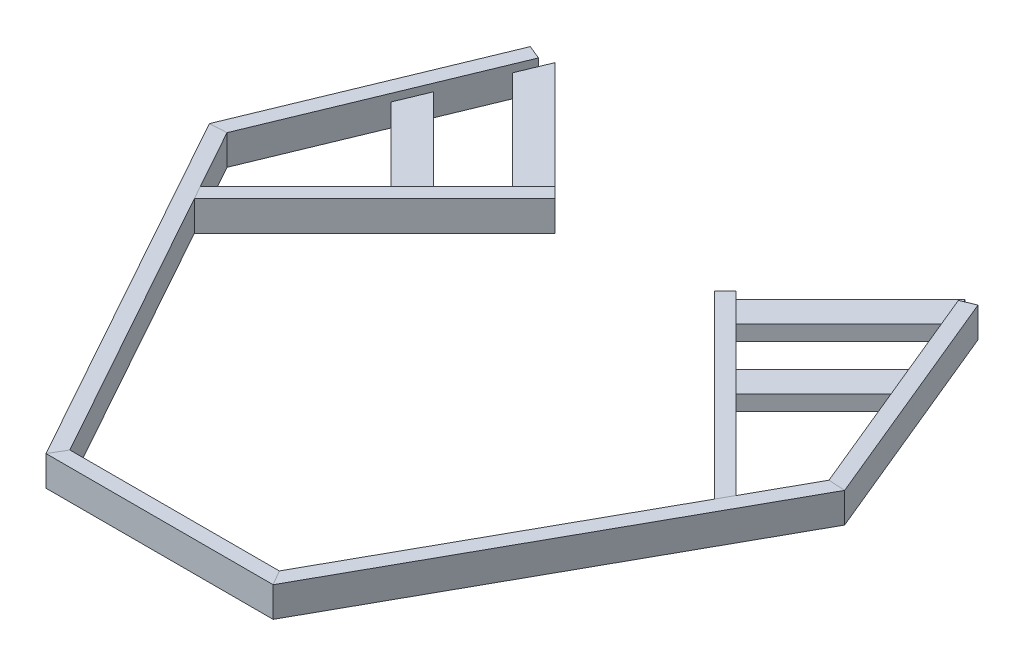
from build123d import *

# Parameters (mm, degrees)
MEMBER_START      = -10
MEMBER_1_DEPTH    = 20
MEMBER_1_2_DEPTH  = 1
MEMBER_START_2    = 9
MEMBER_1_3_DEPTH  = 1
MEMBER_1_4_DEPTH  = 20
MEMBER_1_5_DEPTH  = 1
MEMBER_1_6_DEPTH  = 1
MEMBER_1_7_DEPTH  = 20
MEMBER_1_8_DEPTH  = 1
MEMBER_1_9_DEPTH  = 1
MEMBER_1_10_DEPTH = 20
MEMBER_1_11_DEPTH = 1
MEMBER_1_12_DEPTH = 1
MEMBER_1_13_DEPTH = 20
MEMBER_1_14_DEPTH = 1
MEMBER_1_15_DEPTH = 1
MEMBER_1_16_DEPTH = 20
MEMBER_1_17_DEPTH = 1
MEMBER_1_18_DEPTH = 1
MEMBER_START_3    = -5
MEMBER_1_19_DEPTH = 1
MEMBER_START_4    = 4
MEMBER_1_20_DEPTH = 1
MEMBER_START_5    = -4
MEMBER_1_21_DEPTH = 8
MEMBER_1_22_DEPTH = 1
MEMBER_1_23_DEPTH = 1
MEMBER_1_24_DEPTH = 8


# Read off the part's stored shape, not the designer's step: 结构构件1
with BuildPart() as part:
    # Member 1 outline → Member 1 (new body)
    with BuildSketch(Plane(origin=(0, 0, 0), x_dir=(1, 0, 0), z_dir=(0, 1, 0)).offset(MEMBER_START)):
        Polygon((211.444133454, 33.144126958), (149.013966185, 184.354692044), (148.089647891, 183.973069598), (210.3358297, 33.208131146), align=None)
        Polygon((201.469399669, 33.720164656), (140.695101539, 180.92009003), (139.770783245, 180.538467584), (200.361095915, 33.784168845), align=None)
    extrude(amount=MEMBER_1_DEPTH)

    # Member 1 2 outline → Member 1 2 (add)
    with BuildSketch(Plane(origin=(0, 0, 0), x_dir=(1, 0, 0), z_dir=(0, 1, 0)).offset(MEMBER_START)):
        Polygon((210.3358297, 33.208131146), (148.089647891, 183.973069598), (140.695101539, 180.92009003), (201.469399669, 33.720164656), align=None)
    extrude(amount=MEMBER_1_2_DEPTH)

    # Member 1 3 outline → Member 1 3 (add)
    with BuildSketch(Plane(origin=(0, 0, 0), x_dir=(1, 0, 0), z_dir=(0, 1, 0)).offset(MEMBER_START_2)):
        Polygon((210.3358297, 33.208131146), (148.089647891, 183.973069598), (140.695101539, 180.92009003), (201.469399669, 33.720164656), align=None)
    extrude(amount=MEMBER_1_3_DEPTH)


with BuildPart() as body_2:
    # Member 1 4 outline → Member 1 4 (new body)
    with BuildSketch(Plane(origin=(0, 0, 0), x_dir=(1, 0, 0), z_dir=(0, 1, 0)).offset(MEMBER_START)):
        Polygon((200.361095915, 33.784168845), (69.718713444, -201.469825071), (70.30723549, -202.469825071), (201.469399669, 33.720164656), align=None)
        Polygon((210.3358297, 33.208131146), (75.015411857, -210.469825071), (75.603933902, -211.469825071), (211.444133454, 33.144126958), align=None)
    extrude(amount=MEMBER_1_4_DEPTH)

    # Member 1 5 outline → Member 1 5 (add)
    with BuildSketch(Plane(origin=(0, 0, 0), x_dir=(1, 0, 0), z_dir=(0, 1, 0)).offset(MEMBER_START)):
        Polygon((201.469399669, 33.720164656), (70.30723549, -202.469825071), (75.015411856, -210.469825071), (210.3358297, 33.208131146), align=None)
    extrude(amount=MEMBER_1_5_DEPTH)

    # Member 1 6 outline → Member 1 6 (add)
    with BuildSketch(Plane(origin=(0, 0, 0), x_dir=(1, 0, 0), z_dir=(0, 1, 0)).offset(MEMBER_START_2)):
        Polygon((201.469399669, 33.720164656), (70.30723549, -202.469825071), (75.015411856, -210.469825071), (210.3358297, 33.208131146), align=None)
    extrude(amount=MEMBER_1_6_DEPTH)


with BuildPart() as body_3:
    # Member 1 7 outline → Member 1 7 (new body)
    with BuildSketch(Plane(origin=(0, 0, 0), x_dir=(1, 0, 0), z_dir=(0, 1, 0)).offset(MEMBER_START)):
        Polygon((69.718713444, -201.469825071), (-69.718713444, -201.469825071), (-70.30723549, -202.469825071), (70.30723549, -202.469825071), align=None)
        Polygon((75.015411857, -210.469825071), (-75.015411857, -210.469825071), (-75.603933902, -211.469825071), (75.603933902, -211.469825071), align=None)
    extrude(amount=MEMBER_1_7_DEPTH)

    # Member 1 8 outline → Member 1 8 (add)
    with BuildSketch(Plane(origin=(0, 0, 0), x_dir=(1, 0, 0), z_dir=(0, 1, 0)).offset(MEMBER_START)):
        Polygon((70.30723549, -202.469825071), (-70.30723549, -202.469825071), (-75.015411856, -210.469825071), (75.015411857, -210.469825071), align=None)
    extrude(amount=MEMBER_1_8_DEPTH)

    # Member 1 9 outline → Member 1 9 (add)
    with BuildSketch(Plane(origin=(0, 0, 0), x_dir=(1, 0, 0), z_dir=(0, 1, 0)).offset(MEMBER_START_2)):
        Polygon((70.30723549, -202.469825071), (-70.30723549, -202.469825071), (-75.015411856, -210.469825071), (75.015411857, -210.469825071), align=None)
    extrude(amount=MEMBER_1_9_DEPTH)


with BuildPart() as body_4:
    # Member 1 10 outline → Member 1 10 (new body)
    with BuildSketch(Plane(origin=(0, 0, 0), x_dir=(1, 0, 0), z_dir=(0, 1, 0)).offset(MEMBER_START)):
        Polygon((-69.718713444, -201.469825071), (-200.361095915, 33.784168845), (-201.469399669, 33.720164656), (-70.30723549, -202.469825071), align=None)
        Polygon((-75.015411857, -210.469825071), (-210.3358297, 33.208131146), (-211.444133454, 33.144126958), (-75.603933902, -211.469825071), align=None)
    extrude(amount=MEMBER_1_10_DEPTH)

    # Member 1 11 outline → Member 1 11 (add)
    with BuildSketch(Plane(origin=(0, 0, 0), x_dir=(1, 0, 0), z_dir=(0, 1, 0)).offset(MEMBER_START)):
        Polygon((-70.30723549, -202.469825071), (-201.469399669, 33.720164656), (-210.3358297, 33.208131147), (-75.015411857, -210.469825071), align=None)
    extrude(amount=MEMBER_1_11_DEPTH)

    # Member 1 12 outline → Member 1 12 (add)
    with BuildSketch(Plane(origin=(0, 0, 0), x_dir=(1, 0, 0), z_dir=(0, 1, 0)).offset(MEMBER_START_2)):
        Polygon((-70.30723549, -202.469825071), (-201.469399669, 33.720164656), (-210.3358297, 33.208131147), (-75.015411857, -210.469825071), align=None)
    extrude(amount=MEMBER_1_12_DEPTH)


with BuildPart() as body_5:
    # Member 1 13 outline → Member 1 13 (new body)
    with BuildSketch(Plane(origin=(0, 0, 0), x_dir=(1, 0, 0), z_dir=(0, 1, 0)).offset(MEMBER_START)):
        Polygon((-149.013966185, 184.354692044), (-211.444133454, 33.144126958), (-210.3358297, 33.208131147), (-148.089647891, 183.973069598), align=None)
        Polygon((-140.695101539, 180.92009003), (-201.469399669, 33.720164656), (-200.361095915, 33.784168845), (-139.770783245, 180.538467584), align=None)
    extrude(amount=MEMBER_1_13_DEPTH)

    # Member 1 14 outline → Member 1 14 (add)
    with BuildSketch(Plane(origin=(0, 0, 0), x_dir=(1, 0, 0), z_dir=(0, 1, 0)).offset(MEMBER_START)):
        Polygon((-148.089647891, 183.973069598), (-210.3358297, 33.208131146), (-201.469399669, 33.720164656), (-140.695101539, 180.92009003), align=None)
    extrude(amount=MEMBER_1_14_DEPTH)

    # Member 1 15 outline → Member 1 15 (add)
    with BuildSketch(Plane(origin=(0, 0, 0), x_dir=(1, 0, 0), z_dir=(0, 1, 0)).offset(MEMBER_START_2)):
        Polygon((-148.089647891, 183.973069598), (-210.3358297, 33.208131146), (-201.469399669, 33.720164656), (-140.695101539, 180.92009003), align=None)
    extrude(amount=MEMBER_1_15_DEPTH)


with BuildPart() as body_6:
    # Member 1 16 outline → Member 1 16 (new body)
    with BuildSketch(Plane(origin=(0, 0, 0), x_dir=(1, 0, 0), z_dir=(0, 1, 0)).offset(MEMBER_START)):
        Polygon((-173.184026314, -15.154881759), (-53.191859315, 104.83728524), (-53.898966096, 105.544392022), (-173.688967715, -14.245609598), align=None)
        Polygon((-177.728498928, -6.971432311), (-59.555820345, 111.201246271), (-60.262927127, 111.908353052), (-178.233440329, -6.06216015), align=None)
    extrude(amount=MEMBER_1_16_DEPTH)

    # Member 1 17 outline → Member 1 17 (add)
    with BuildSketch(Plane(origin=(0, 0, 0), x_dir=(1, 0, 0), z_dir=(0, 1, 0)).offset(MEMBER_START)):
        Polygon((-173.688967715, -14.245609598), (-53.898966096, 105.544392022), (-59.555820346, 111.20124627), (-177.728498928, -6.971432311), align=None)
    extrude(amount=MEMBER_1_17_DEPTH)

    # Member 1 18 outline → Member 1 18 (add)
    with BuildSketch(Plane(origin=(0, 0, 0), x_dir=(1, 0, 0), z_dir=(0, 1, 0)).offset(MEMBER_START_2)):
        Polygon((-173.688967715, -14.245609598), (-53.898966096, 105.544392022), (-59.555820346, 111.20124627), (-177.728498928, -6.971432311), align=None)
    extrude(amount=MEMBER_1_18_DEPTH)


with BuildPart() as body_7:
    # Member 1 19 outline → Member 1 19 (new body)
    with BuildSketch(Plane(origin=(0, 0, 0), x_dir=(1, 0, 0), z_dir=(0, 1, 0)).offset(MEMBER_START_3)):
        Polygon((-74.40506275, 97.766217429), (-60.262927127, 111.908353052), (-136.592085909, 188.237511835), (-144.857325246, 168.218479924), align=None)
    extrude(amount=MEMBER_1_19_DEPTH)

    # Member 1 20 outline → Member 1 20 (add)
    with BuildSketch(Plane(origin=(0, 0, 0), x_dir=(1, 0, 0), z_dir=(0, 1, 0)).offset(MEMBER_START_4)):
        Polygon((-74.40506275, 97.766217429), (-60.262927127, 111.908353052), (-136.592085909, 188.237511835), (-144.857325246, 168.218479924), align=None)
    extrude(amount=MEMBER_1_20_DEPTH)

    # Member 1 21 outline → Member 1 21 (add)
    with BuildSketch(Plane(origin=(0, 0, 0), x_dir=(1, 0, 0), z_dir=(0, 1, 0)).offset(MEMBER_START_5)):
        Polygon((-74.40506275, 97.766217429), (-73.697955969, 98.47332421), (-144.444063279, 169.21943152), (-144.857325246, 168.218479924), align=None)
        Polygon((-137.005347876, 187.236560239), (-60.970033908, 111.201246271), (-60.262927127, 111.908353052), (-136.592085909, 188.237511835), align=None)
    extrude(amount=MEMBER_1_21_DEPTH)


with BuildPart() as body_8:
    # Member 1 22 outline → Member 1 22 (new body)
    with BuildSketch(Plane(origin=(0, 0, 0), x_dir=(1, 0, 0), z_dir=(0, 1, 0)).offset(MEMBER_START_3)):
        Polygon((-114.710149278, 57.461130901), (-100.568013654, 71.603266525), (-160.148018019, 131.18327089), (-168.413257356, 111.164238979), align=None)
    extrude(amount=MEMBER_1_22_DEPTH)

    # Member 1 23 outline → Member 1 23 (add)
    with BuildSketch(Plane(origin=(0, 0, 0), x_dir=(1, 0, 0), z_dir=(0, 1, 0)).offset(MEMBER_START_4)):
        Polygon((-114.710149278, 57.461130901), (-100.568013654, 71.603266525), (-160.148018019, 131.18327089), (-168.413257356, 111.164238979), align=None)
    extrude(amount=MEMBER_1_23_DEPTH)

    # Member 1 24 outline → Member 1 24 (add)
    with BuildSketch(Plane(origin=(0, 0, 0), x_dir=(1, 0, 0), z_dir=(0, 1, 0)).offset(MEMBER_START_5)):
        Polygon((-114.710149278, 57.461130901), (-114.003042497, 58.168237682), (-167.99999539, 112.165190575), (-168.413257356, 111.164238979), align=None)
        Polygon((-160.561279986, 130.182319294), (-101.275120435, 70.896159743), (-100.568013654, 71.603266525), (-160.148018019, 131.18327089), align=None)
    extrude(amount=MEMBER_1_24_DEPTH)


with BuildPart() as body_9:
    # 镜向1: mirrored copy
    add(body_7.part.mirror(Plane(origin=(0, 0, 0), x_dir=(0, 0, 1), z_dir=(1, 0, 0))))


with BuildPart() as body_10:
    # Mirror 1 2: mirrored copy
    add(body_8.part.mirror(Plane(origin=(0, 0, 0), x_dir=(0, 0, 1), z_dir=(1, 0, 0))))


with BuildPart() as body_11:
    # Mirror 1 3: mirrored copy
    add(body_6.part.mirror(Plane(origin=(0, 0, 0), x_dir=(0, 0, 1), z_dir=(1, 0, 0))))


solid = Compound([part.part, body_2.part, body_3.part, body_4.part, body_5.part, body_6.part, body_7.part, body_8.part, body_9.part, body_10.part, body_11.part])
